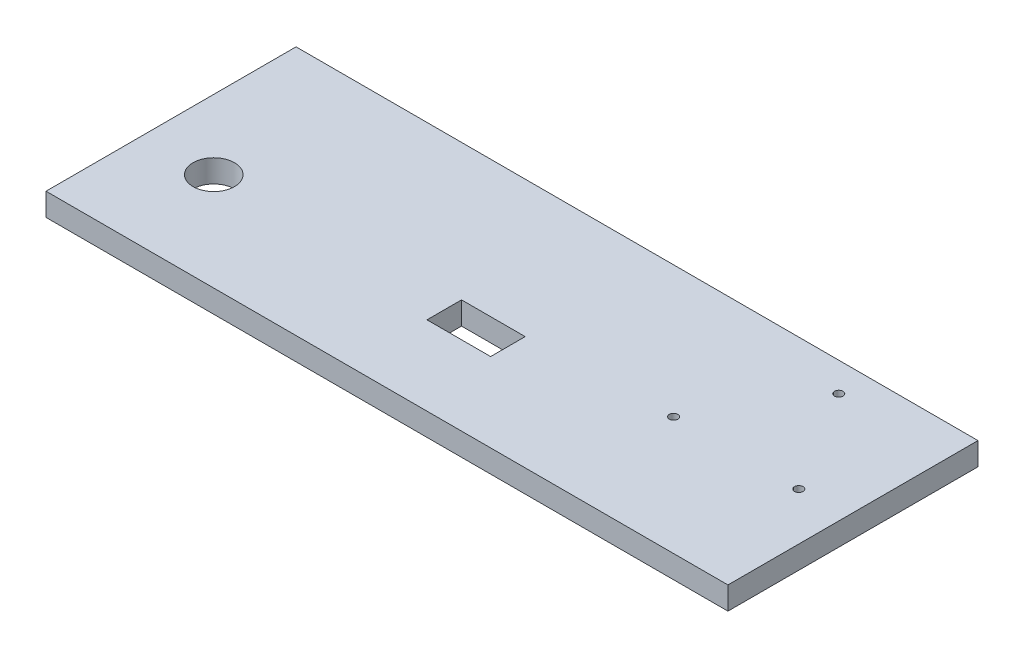
from build123d import *

# Parameters (mm, degrees)
SKETCH1_W                 = 95.25
SKETCH1_H                 = 34.925
BOSS_EXTRUDE1_DEPTH       = 3.175
TAP_DRILL_FOR_0_80_TAP1_D = 1.19126
F_12_CLEARANCE_HOLE1_D    = 5.7912
SKETCH6_W                 = 8.89
SKETCH6_H                 = 4.826
CUT_EXTRUDE1_DEPTH        = 51.824798635


with BuildPart() as part:
    # Sketch1 → Boss-Extrude1 (new body)
    with BuildSketch(Plane(origin=(0, 0, 0), x_dir=(1, 0, 0), z_dir=(0, 1, 0))):
        Rectangle(SKETCH1_W, SKETCH1_H)
    extrude(amount=BOSS_EXTRUDE1_DEPTH)

    # Tap Drill for #0-80 Tap1 (through all)
    with Locations(Plane(origin=(0, 3.175, 0), x_dir=(1, 0, 0), z_dir=(0, 1, 0))):
        with Locations((40.97655, -0.920821886), (23.48865, -0.920821886), (32.2326, 13.40485)):
            Hole(TAP_DRILL_FOR_0_80_TAP1_D / 2)

    # #12 Clearance Hole1 (through all)
    with Locations(Plane(origin=(0, 3.175, 0), x_dir=(1, 0, 0), z_dir=(0, 1, 0))):
        with Locations((-37.9095, -3.7465)):
            Hole(F_12_CLEARANCE_HOLE1_D / 2)

    # Sketch6 → Cut-Extrude1 (cut, through all)
    with BuildSketch(Plane(origin=(0, 3.175, 0), x_dir=(1, 0, 0), z_dir=(0, 1, 0))):
        with Locations((-1.016, -4.0005)):
            Rectangle(SKETCH6_W, SKETCH6_H)
    extrude(amount=-CUT_EXTRUDE1_DEPTH, mode=Mode.SUBTRACT)


solid = part.part
